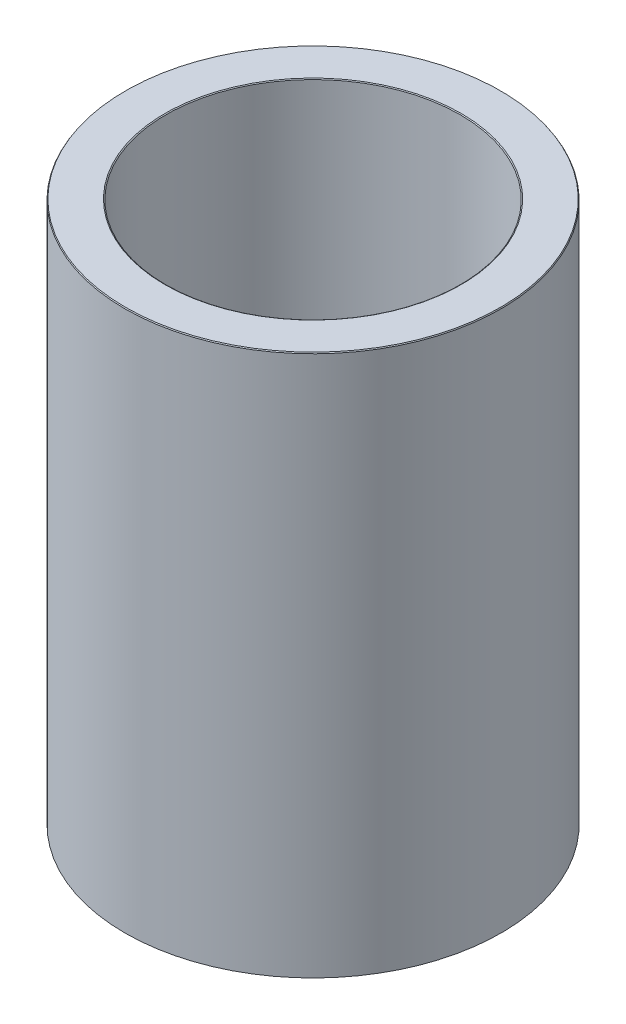
from build123d import *
from OCP.BRepFilletAPI import BRepFilletAPI_MakeChamfer

# Parameters (mm, degrees)
SKETCH1_R           = 55
BOSS_EXTRUDE1_DEPTH = 158.491382979
SKETCH2_R           = 43.041133028
CUT_EXTRUDE1_DEPTH  = 177.548912425
CHAMFER1_SIZE       = 0.285057206
CHAMFER1_SIZE2      = 0.184009061


with BuildPart() as part:
    # Sketch1 → Boss-Extrude1 (new body)
    with BuildSketch(Plane(origin=(0, 0, 0), x_dir=(1, 0, 0), z_dir=(0, 1, 0))):
        Circle(SKETCH1_R)
    extrude(amount=BOSS_EXTRUDE1_DEPTH)

    # Sketch2 → Cut-Extrude1 (cut, through all)
    with BuildSketch(Plane(origin=(0, 0, 0), x_dir=(1, 0, 0), z_dir=(0, 1, 0))):
        Circle(SKETCH2_R)
    extrude(amount=CUT_EXTRUDE1_DEPTH, mode=Mode.SUBTRACT)

    # Chamfer1: one chamfer whose edges measure the first distance from different faces: ONE call of the kernel's chamfer builder (chamfer() names one face for all edges)
    chamfer1_edges_1 = [part.edges().sort_by_distance(p)[0] for p in [
        (-43.041133028, 158.491382979, 0),
    ]]
    chamfer1_side_1 = [part.faces().sort_by_distance(p)[0] for p in [
        (-53.444365081, 158.491382979, 0),
    ]]
    chamfer1_edges_2 = [part.edges().sort_by_distance(p)[0] for p in [
        (-43.041133028, 0, 0),
    ]]
    chamfer1_side_2 = [part.faces().sort_by_distance(p)[0] for p in [
        (-43.041133028, 79.24569149, 0),
    ]]
    chamfer1_edges_3 = [part.edges().sort_by_distance(p)[0] for p in [
        (-55, 0, 0),
    ]]
    chamfer1_side_3 = [part.faces().sort_by_distance(p)[0] for p in [
        (-53.444365081, 0, 0),
    ]]
    chamfer1_edges_4 = [part.edges().sort_by_distance(p)[0] for p in [
        (-55, 158.491382979, 0),
    ]]
    chamfer1_side_4 = [part.faces().sort_by_distance(p)[0] for p in [
        (-55, 79.24569149, 0),
    ]]
    chamfer1 = BRepFilletAPI_MakeChamfer(part.part.solid().wrapped)
    for e in chamfer1_edges_1:
        chamfer1.Add(CHAMFER1_SIZE, CHAMFER1_SIZE2, e.wrapped, chamfer1_side_1[0].wrapped)  # the first distance lies on this face
    for e in chamfer1_edges_2:
        chamfer1.Add(CHAMFER1_SIZE, CHAMFER1_SIZE2, e.wrapped, chamfer1_side_2[0].wrapped)  # the first distance lies on this face
    for e in chamfer1_edges_3:
        chamfer1.Add(CHAMFER1_SIZE, CHAMFER1_SIZE2, e.wrapped, chamfer1_side_3[0].wrapped)  # the first distance lies on this face
    for e in chamfer1_edges_4:
        chamfer1.Add(CHAMFER1_SIZE, CHAMFER1_SIZE2, e.wrapped, chamfer1_side_4[0].wrapped)  # the first distance lies on this face
    add(Compound.cast(chamfer1.Shape()), mode=Mode.REPLACE)


solid = part.part
